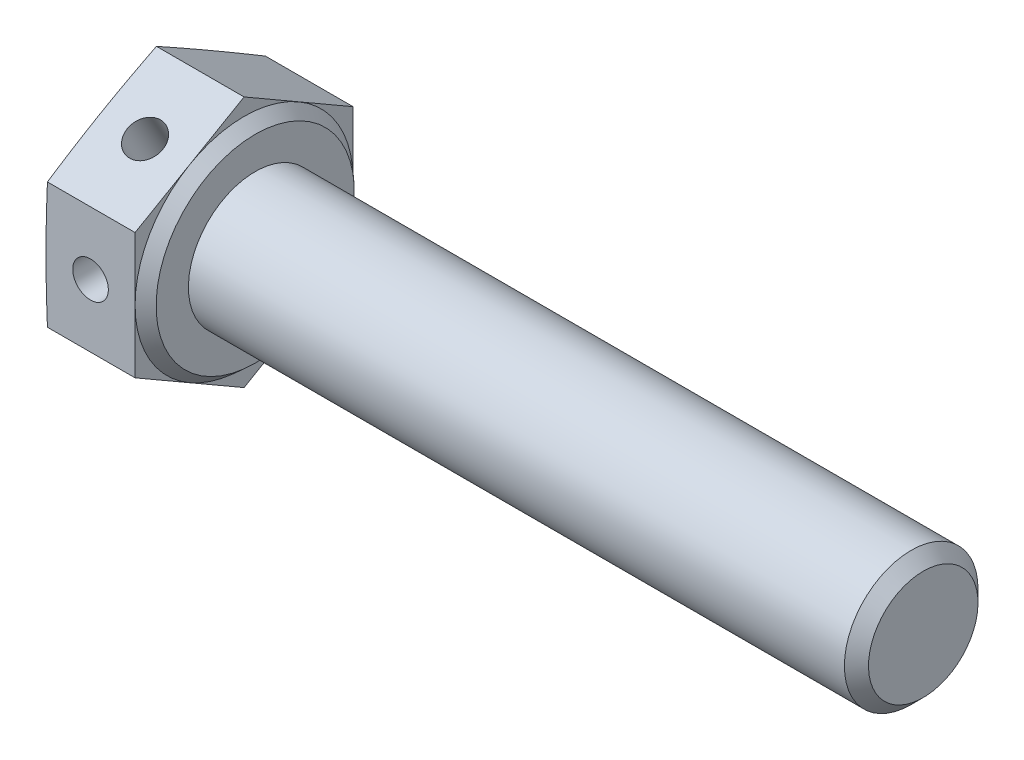
from build123d import *

# Parameters (mm, degrees)
BASEHEAD_DEPTH    = 4
SKETCH3_R         = 3
BASEBODY_DEPTH    = 30
CHAMFER1_SIZE     = 0.5415
SKETCH5_R         = 0.8
HOLE_DEPTH        = 36.30097815
CIRPATTERN1_COUNT = 2
CIRPATTERN1_ANGLE = 60


with BuildPart() as part:
    # Sketch-BaseHead → BaseHead (new body)
    with BuildSketch(Plane(origin=(0, 0, 0), x_dir=(0, 0, -1), z_dir=(1, 0, 0))):
        Polygon((0, -5.652259135), (4.895, -2.826129568), (4.895, 2.826129568), (0, 5.652259135), (-4.895, 2.826129568), (-4.895, -2.826129568), align=None)
    extrude(amount=BASEHEAD_DEPTH)

    # Sketch4 → HeadChamfer (revolve, cut)
    with BuildSketch(Plane(origin=(-0.264637255, -5.916896391, 0), x_dir=(0, 1, 0), z_dir=(0, 0, 1))):
        Polygon((11.569155526, -0.264637255), (10.811896391, -0.264637255), (11.569155526, -0.329490696), align=None)
    revolve(axis=Axis((-4.001564945, 0, 0), (1, 0, 0)), mode=Mode.SUBTRACT)

    # Sketch2 → Revolve1 (revolve)
    with BuildSketch(Plane(origin=(0, 0, 0), x_dir=(1, 0, 0), z_dir=(0, 1, 0))):
        Polygon((4, 0), (4.5, 0), (4.5, 4.45), (4, 4.895), align=None)
    revolve(axis=Axis((-4.001564945, 0, 0), (1, 0, 0)))

    # Sketch3 → BaseBody (add)
    with BuildSketch(Plane(origin=(4.5, 0, 0), x_dir=(0, 0, -1), z_dir=(1, 0, 0))):
        Circle(SKETCH3_R)
    extrude(amount=BASEBODY_DEPTH)

    # Chamfer1
    chamfer1_edges = [part.edges().sort_by_distance(p)[0] for p in [
        (34.5, 0, 3),
    ]]
    chamfer(chamfer1_edges, length=CHAMFER1_SIZE)

    # Sketch5 → Hole (cut, symmetric)
    with BuildSketch(Plane.XY):
        with Locations((2, 0)):
            Circle(SKETCH5_R)
    hole = extrude(amount=HOLE_DEPTH, both=True, mode=Mode.SUBTRACT)

    # CirPattern1: Hole ×2 about axis
    cirpattern1_axis = Axis((34.5, 0, 0), (-1, 0, 0))
    for i in range(1, CIRPATTERN1_COUNT):
        add(hole.rotate(cirpattern1_axis, i * CIRPATTERN1_ANGLE / (CIRPATTERN1_COUNT - 1)), mode=Mode.SUBTRACT)


solid = part.part
